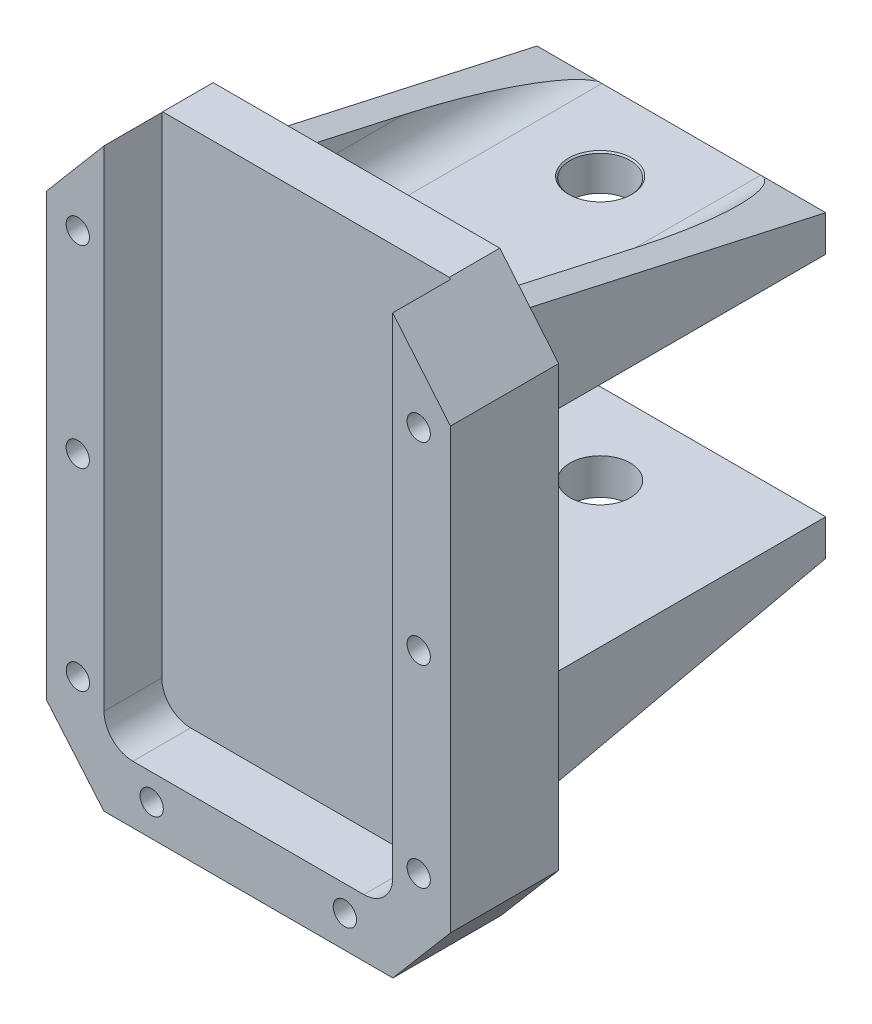
from build123d import *

# Parameters (mm, degrees)
SKETCH1_W                      = 35.56
SKETCH1_H                      = 50.8
BOSS_EXTRUDE1_DEPTH            = 9.525
SKETCH2_W                      = 25.4
SKETCH2_H                      = 45.72
CUT_EXTRUDE2_DEPTH             = 5.08
TAP_DRILL_FOR_M2_5X0_45_TAP1_D = 2.05
SKETCH13_W                     = 25.4
SKETCH13_H                     = 3.175
BOSS_EXTRUDE2_DEPTH            = 28.575
CUT_EXTRUDE3_DEPTH             = 73.778867812
FILLET1_R                      = 2.54
M5_CLEARANCE_HOLE1_D           = 5.3
M5_CLEARANCE_HOLE1_CSINK_D     = 5.55
M5_CLEARANCE_HOLE1_CSINK_ANGLE = 90
RIB7_REACH                     = 67.774
SKETCH14_WALL_W                = 162.819779212
SKETCH14_WALL_H                = 2.54
RIB8_REACH                     = 67.774
SKETCH15_WALL_W                = 162.819779212
SKETCH15_WALL_H                = 2.54
RIB9_REACH                     = 67.774
SKETCH17_WALL_W                = 162.819779212
SKETCH17_WALL_H                = 2.54
RIB10_REACH                    = 67.774
SKETCH16_WALL_W                = 162.819779212
SKETCH16_WALL_H                = 2.54
FILLET2_R                      = 3.175
FILLET3_R                      = 3.175


with BuildPart() as part:
    # Sketch1 → Boss-Extrude1 (new body)
    with BuildSketch(Plane.XY):
        with Locations((-17.78, 25.4)):
            Rectangle(SKETCH1_W, SKETCH1_H)
    extrude(amount=BOSS_EXTRUDE1_DEPTH)

    # Sketch2 → Cut-Extrude2 (cut)
    with BuildSketch(Plane.XY.offset(9.525)):
        with Locations((-17.78, 27.94)):
            Rectangle(SKETCH2_W, SKETCH2_H)
    extrude(amount=-CUT_EXTRUDE2_DEPTH, mode=Mode.SUBTRACT)

    # Tap Drill for M2.5x0.45 Tap1 (through all)
    with Locations(Plane(origin=(0, 0, 0), x_dir=(-1, 0, 0), z_dir=(0, 0, -1))):
        with Locations((2.792369004, 43.087106138), (2.792369004, 26.092979092), (2.792369004, 9.105182099), (9.290740849, 2.822744672), (26.292369004, 2.787106138), (32.780032006, 9.105182099), (32.792369004, 26.087106138), (32.792369004, 43.087106138)):
            Hole(TAP_DRILL_FOR_M2_5X0_45_TAP1_D / 2)

    # Sketch13 → Boss-Extrude2 (add)
    with BuildSketch(Plane(origin=(0, 0, 0), x_dir=(-1, 0, 0), z_dir=(0, 0, -1))):
        with Locations((17.78, 37.677545037)):
            Rectangle(SKETCH13_W, SKETCH13_H)
        with Locations((17.78, 14.502545037)):
            Rectangle(SKETCH13_W, SKETCH13_H)
    extrude(amount=BOSS_EXTRUDE2_DEPTH)

    # Sketch8 → Cut-Extrude3 (cut, through all)
    with BuildSketch(Plane.XY.offset(9.525)):
        Polygon((-5.178964387, 50.8), (0, 44.591495864), (0, 50.8), align=None)
        Polygon((-35.56, 44.706622517), (-35.56, 50.8), (-30.402645731, 50.8), align=None)
        Polygon((-35.56, 5.970049098), (-35.56, 0), (-30.492594088, 0), align=None)
        Polygon((-5.092594088, -0.031324356), (0, 0), (0, 5.970049098), align=None)
    extrude(amount=-CUT_EXTRUDE3_DEPTH, mode=Mode.SUBTRACT)

    # Fillet1
    fillet1_edges = [part.edges().sort_by_distance(p)[0] for p in [
        (-5.08, 5.08, 6.985),
        (-30.48, 5.08, 6.985),
    ]]
    fillet(fillet1_edges, radius=FILLET1_R)

    # M5 Clearance Hole1 (through all)
    with Locations(Plane(origin=(-17.78, 39.265045037, -7.14375), x_dir=(0, 0, 1), z_dir=(0, 1, 0))):
        with Locations((0, 0), (-14.2875, 0)):
            CounterSinkHole(M5_CLEARANCE_HOLE1_D / 2, M5_CLEARANCE_HOLE1_CSINK_D / 2, counter_sink_angle=M5_CLEARANCE_HOLE1_CSINK_ANGLE)

    # Sketch14 wall → Rib7 (add, up to next)
    with BuildSketch(Plane(origin=(-30.48, 9.740045037, -14.2875), x_dir=(0, -0.216930457819, 0.976187060184), z_dir=(0, 0.976187060184, 0.216930457819)), mode=Mode.PRIVATE) as rib7_sk1:
        with Locations((0, 1.27)):
            Rectangle(SKETCH14_WALL_W, SKETCH14_WALL_H)
    rib7_tool1 = extrude(rib7_sk1.sketch, amount=RIB7_REACH, mode=Mode.PRIVATE) - part.part
    add(rib7_tool1.solids().sort_by_distance((-30.48, 9.740045037, -14.2875))[0])

    # Sketch15 wall → Rib8 (add, up to next)
    with BuildSketch(Plane(origin=(-5.08, 9.740045037, -14.2875), x_dir=(0, -0.216930457819, 0.976187060184), z_dir=(0, -0.976187060184, -0.216930457819)), mode=Mode.PRIVATE) as rib8_sk1:
        with Locations((0, 1.27)):
            Rectangle(SKETCH15_WALL_W, SKETCH15_WALL_H)
    rib8_tool1 = extrude(rib8_sk1.sketch, amount=-RIB8_REACH, mode=Mode.PRIVATE) - part.part
    add(rib8_tool1.solids().sort_by_distance((-5.08, 9.740045037, -14.2875))[0])

    # Sketch17 wall → Rib9 (add, up to next)
    with BuildSketch(Plane(origin=(-5.08, 42.440045037, -14.2875), x_dir=(0, 0.216930457819, 0.976187060184), z_dir=(0, -0.976187060184, 0.216930457819)), mode=Mode.PRIVATE) as rib9_sk1:
        with Locations((0, 1.27)):
            Rectangle(SKETCH17_WALL_W, SKETCH17_WALL_H)
    rib9_tool1 = extrude(rib9_sk1.sketch, amount=RIB9_REACH, mode=Mode.PRIVATE) - part.part
    add(rib9_tool1.solids().sort_by_distance((-5.08, 42.440045037, -14.2875))[0])

    # Sketch16 wall → Rib10 (add, up to next)
    with BuildSketch(Plane(origin=(-30.48, 42.440045037, -14.2875), x_dir=(0, 0.216930457819, 0.976187060184), z_dir=(0, 0.976187060184, -0.216930457819)), mode=Mode.PRIVATE) as rib10_sk1:
        with Locations((0, 1.27)):
            Rectangle(SKETCH16_WALL_W, SKETCH16_WALL_H)
    rib10_tool1 = extrude(rib10_sk1.sketch, amount=-RIB10_REACH, mode=Mode.PRIVATE) - part.part
    add(rib10_tool1.solids().sort_by_distance((-30.48, 42.440045037, -14.2875))[0])

    # Fillet2
    fillet2_edges = [part.edges().sort_by_distance(p)[0] for p in [
        (-27.94, 12.915045037, -14.2875),
        (-7.62, 12.915045037, -14.2875),
    ]]
    fillet(fillet2_edges, radius=FILLET2_R)

    # Fillet3
    fillet3_edges = [part.edges().sort_by_distance(p)[0] for p in [
        (-7.62, 39.265045037, -14.2875),
        (-27.94, 39.265045037, -14.2875),
    ]]
    fillet(fillet3_edges, radius=FILLET3_R)


solid = part.part
